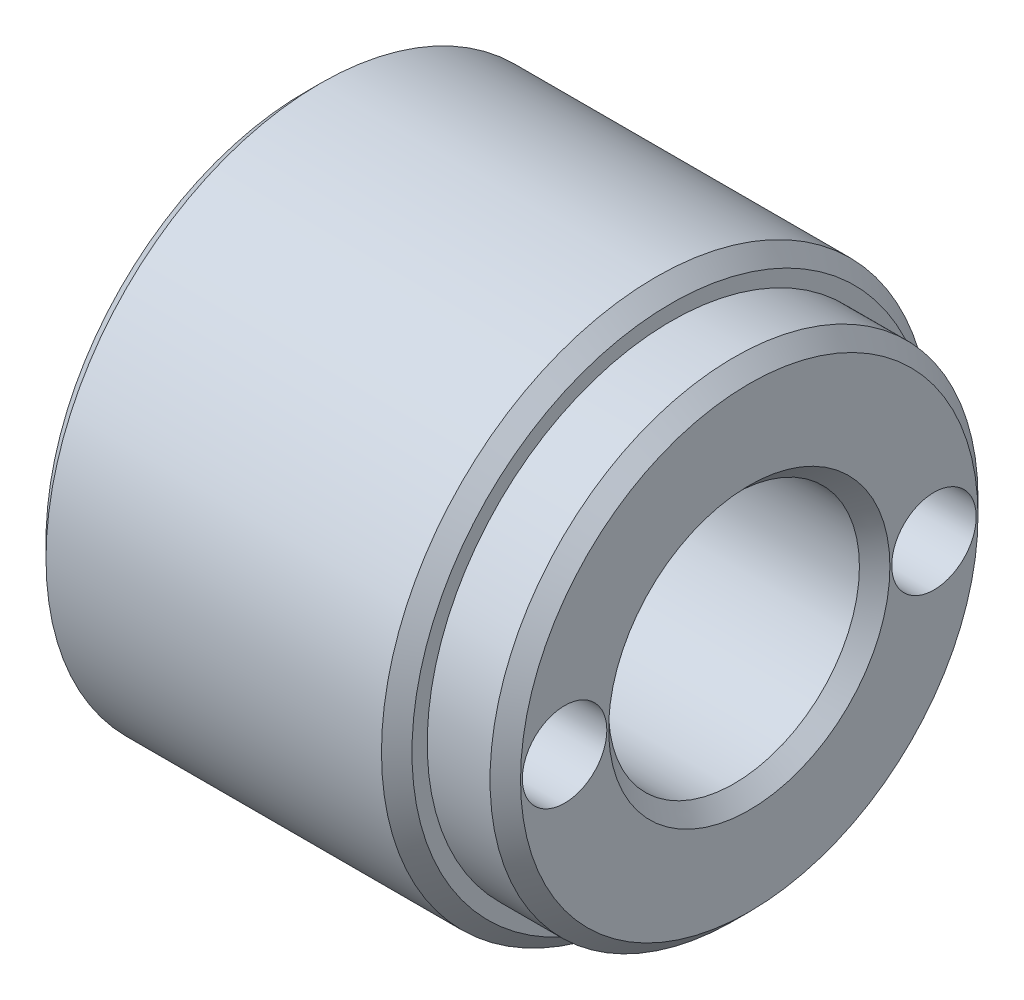
from build123d import *

# Parameters (mm, degrees)
SKETCH1_R                                 = 6.35
SKETCH1_R_2                               = 1.099999959
SKETCH1_R_3                               = 3.2639
INNER_SIDE_EXTRUDE_DEPTH                  = 2.032
OUTER_START                               = -9.525
SKETCH1_3_R                               = 7.14375
SKETCH1_3_R_2                             = 1.099999959
SKETCH1_3_R_3                             = 3.2639
OUTER_SIDE_EXTRUDE_DEPTH                  = 9.525
CHAMFER_SO_STEVE_DOESN_T_CUT_HIMSELF_SIZE = 0.396875


with BuildPart() as part:
    # Sketch1 → Inner Side Extrude (new body)
    with BuildSketch(Plane(origin=(0, 0, 0), x_dir=(0, 0, -1), z_dir=(1, 0, 0))):
        Circle(SKETCH1_R)
        with Locations((-4.80695, 0)):
            Circle(SKETCH1_R_2, mode=Mode.SUBTRACT)
        Circle(SKETCH1_R_3, mode=Mode.SUBTRACT)
        with Locations((4.80695, 0)):
            Circle(SKETCH1_R_2, mode=Mode.SUBTRACT)
    extrude(amount=INNER_SIDE_EXTRUDE_DEPTH)

    # Sketch1<3> → Outer Side Extrude (add)
    with BuildSketch(Plane(origin=(0, 0, 0), x_dir=(0, 0, -1), z_dir=(1, 0, 0)).offset(OUTER_START)):
        Circle(SKETCH1_3_R)
        with Locations((-4.80695, 0)):
            Circle(SKETCH1_3_R_2, mode=Mode.SUBTRACT)
        Circle(SKETCH1_3_R_3, mode=Mode.SUBTRACT)
        with Locations((4.80695, 0)):
            Circle(SKETCH1_3_R_2, mode=Mode.SUBTRACT)
    extrude(amount=OUTER_SIDE_EXTRUDE_DEPTH)

    # Chamfer so Steve Doesn't cut himself
    chamfer_so_steve_doesn_t_cut_himself_edges = [part.edges().sort_by_distance(p)[0] for p in [
        (-9.525, 0, 3.2639),
        (2.032, 0, 3.2639),
        (2.032, 0, 6.35),
        (-9.525, 0, 7.14375),
        (0, 0, 7.14375),
    ]]
    chamfer(chamfer_so_steve_doesn_t_cut_himself_edges, length=CHAMFER_SO_STEVE_DOESN_T_CUT_HIMSELF_SIZE)


solid = part.part
